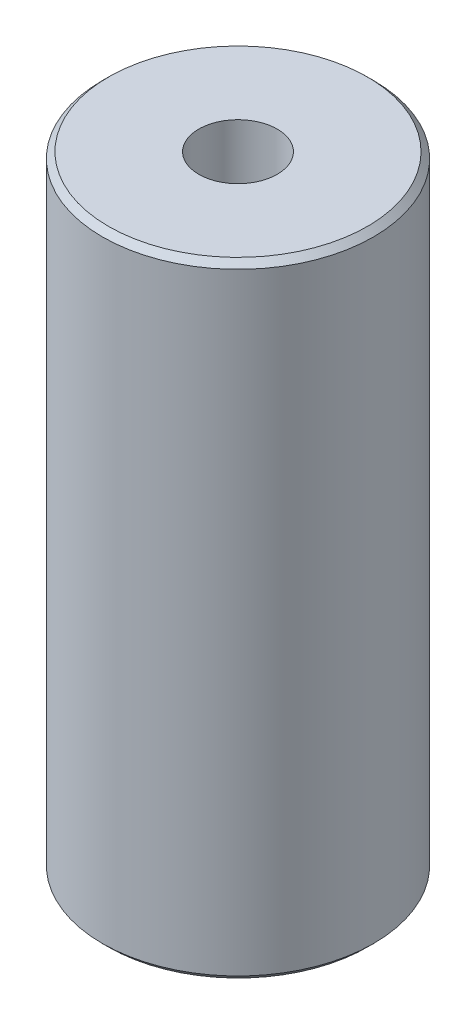
from build123d import *

# Parameters (mm, degrees)
SKETCH1_R           = 55
BOSS_EXTRUDE1_DEPTH = 253.295356816
SKETCH2_R           = 15.927591014
CUT_EXTRUDE1_DEPTH  = 265.968937396
CHAMFER1_SIZE       = 2.464806161


with BuildPart() as part:
    # Sketch1 → Boss-Extrude1 (new body)
    with BuildSketch(Plane(origin=(0, 0, 0), x_dir=(1, 0, 0), z_dir=(0, 1, 0))):
        Circle(SKETCH1_R)
    extrude(amount=BOSS_EXTRUDE1_DEPTH)

    # Sketch2 → Cut-Extrude1 (cut, through all)
    with BuildSketch(Plane(origin=(0, 0, 0), x_dir=(1, 0, 0), z_dir=(0, 1, 0))):
        Circle(SKETCH2_R)
    extrude(amount=CUT_EXTRUDE1_DEPTH, mode=Mode.SUBTRACT)

    # Chamfer1
    chamfer1_edges = [part.edges().sort_by_distance(p)[0] for p in [
        (-55, 253.295356816, 0),
        (-55, 0, 0),
    ]]
    chamfer(chamfer1_edges, length=CHAMFER1_SIZE)


solid = part.part
